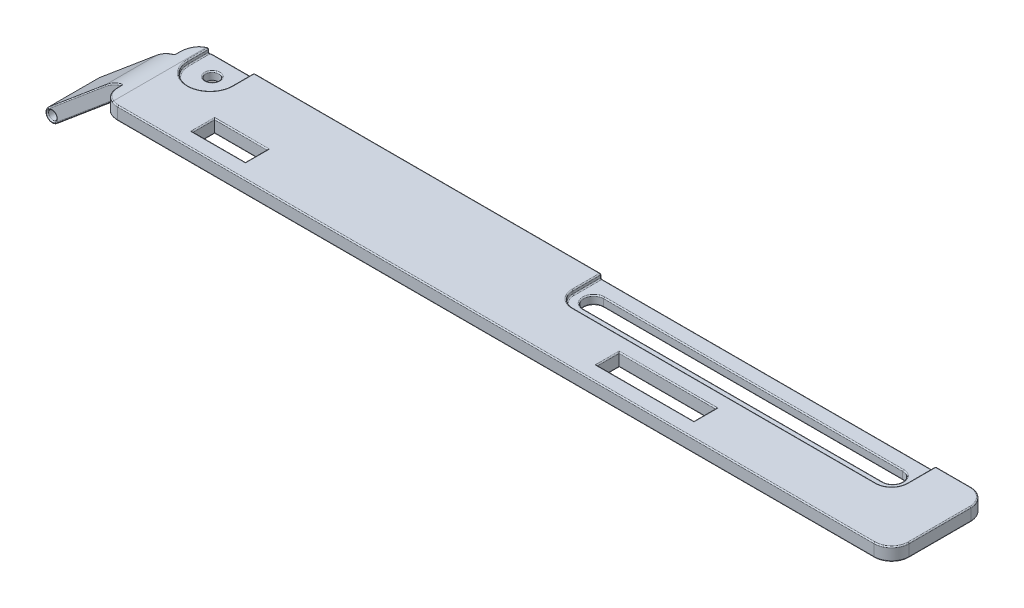
from build123d import *

# Parameters (mm, degrees)
BOSS_EXTRUDE1_DEPTH      = 11
BOSS_EXTRUDE1_DEPTH_BACK = 11
SKETCH1_R                = 1
SKETCH2_W                = 30.149933191
SKETCH2_H                = 27.250901153
CUT_EXTRUDE1_DEPTH       = 5
SKETCH3_W                = 71.820543682
SKETCH3_H                = 83.600632857
CUT_EXTRUDE2_DEPTH       = 5
CUT_EXTRUDE3_REACH       = 200.411
SKETCH4_W                = 12
SKETCH4_H                = 5
SKETCH4_W_2              = 22
CUT_EXTRUDE4_DEPTH       = 1
CUT_EXTRUDE5_REACH       = 200.411
SKETCH6_R                = 1.5
FILLET1_R                = 4
FILLET2_R                = 0.25


with BuildPart() as part:
    # Sketch1 → Boss-Extrude1 (new, two sides: drawn at the far end of the back side and taken through both)
    with BuildSketch(Plane.XY.offset(-BOSS_EXTRUDE1_DEPTH_BACK)):
        with BuildLine():
            Line((-182.788173754, -2.339555569), (-195, -12.586494468))
            ThreePointArc((-195, -12.586494468), (-197.113248079, -12.401609218), (-196.928362829, -10.288361138))
            Line((-196.928362829, -10.288361138), (-183.880084457, 0.660444431))
            ThreePointArc((-183.880084457, 0.660444431), (-180.872409793, 2.396926208), (-177.45220836, 3))
            Line((-177.45220836, 3), (0, 3))
            Line((0, 3), (0, 0))
            Line((0, 0), (-176.360297657, 0))
            ThreePointArc((-176.360297657, 0), (-179.780499091, -0.603073792), (-182.788173754, -2.339555569))
        make_face()
        with Locations((-195.964181415, -11.437427803)):
            Circle(SKETCH1_R, mode=Mode.SUBTRACT)
    extrude(amount=BOSS_EXTRUDE1_DEPTH + BOSS_EXTRUDE1_DEPTH_BACK)

    # Sketch2 → Cut-Extrude1 (cut)
    with BuildSketch(Plane.XY.offset(11)):
        with Locations((-195.074966596, -3.959703737)):
            Rectangle(SKETCH2_W, SKETCH2_H)
    extrude(amount=-CUT_EXTRUDE1_DEPTH, mode=Mode.SUBTRACT)

    # Sketch3 → Cut-Extrude2 (cut)
    with BuildSketch(Plane(origin=(0, 0, -11), x_dir=(-1, 0, 0), z_dir=(0, 0, -1))):
        with Locations((215.910271841, -13.071084551)):
            Rectangle(SKETCH3_W, SKETCH3_H)
    extrude(amount=-CUT_EXTRUDE2_DEPTH, mode=Mode.SUBTRACT)

    # Sketch4 → Cut-Extrude3 (cut, up to next)
    with BuildSketch(Plane(origin=(0, 3, 0), x_dir=(1, 0, 0), z_dir=(0, 1, 0)), mode=Mode.PRIVATE) as cut_extrude3_sk1:
        with Locations((-156.45220836, -5)):
            Rectangle(SKETCH4_W, SKETCH4_H)
    cut_extrude3_tool1 = extrude(cut_extrude3_sk1.sketch, amount=-CUT_EXTRUDE3_REACH, mode=Mode.PRIVATE) & part.part
    # Sketch4 → Cut-Extrude3 (cut, up to next)
    with BuildSketch(Plane(origin=(0, 3, 0), x_dir=(1, 0, 0), z_dir=(0, 1, 0)), mode=Mode.PRIVATE) as cut_extrude3_sk2:
        with Locations((-59.45220836, -5)):
            Rectangle(SKETCH4_W_2, SKETCH4_H)
    cut_extrude3_tool2 = extrude(cut_extrude3_sk2.sketch, amount=-CUT_EXTRUDE3_REACH, mode=Mode.PRIVATE) & part.part
    add(cut_extrude3_tool1.solids().sort_by_distance((-156.452208, 3, 5))[0], mode=Mode.SUBTRACT)
    add(cut_extrude3_tool2.solids().sort_by_distance((-59.452208, 3, 5))[0], mode=Mode.SUBTRACT)

    # Sketch5 → Cut-Extrude4 (cut)
    with BuildSketch(Plane(origin=(0, 3, 0), x_dir=(1, 0, 0), z_dir=(0, 1, 0))):
        with BuildLine():
            Line((-88, 11), (-12, 11))
            Line((-12, 11), (-12, 4.5))
            ThreePointArc((-12, 4.5), (-13.025126266, 2.025126266), (-15.5, 1))
            Line((-15.5, 1), (-84.5, 1))
            ThreePointArc((-84.5, 1), (-86.974873734, 2.025126266), (-88, 4.5))
            Line((-88, 4.5), (-88, 11))
        make_face()
        with BuildLine():
            Line((-177, 6), (-177, 11))
            Line((-177, 11), (-167, 11))
            Line((-167, 11), (-167, 6))
            ThreePointArc((-167, 6), (-172, 1), (-177, 6))
        make_face()
    extrude(amount=-CUT_EXTRUDE4_DEPTH, mode=Mode.SUBTRACT)

    # Sketch6 → Cut-Extrude5 (cut, up to next)
    with BuildSketch(Plane(origin=(0, 3, 0), x_dir=(1, 0, 0), z_dir=(0, 1, 0)), mode=Mode.PRIVATE) as cut_extrude5_sk1:
        with Locations(Location((-172, 6.5, 0), (0, 0, 180))):
            Circle(SKETCH6_R)
    cut_extrude5_tool1 = extrude(cut_extrude5_sk1.sketch, amount=-CUT_EXTRUDE5_REACH, mode=Mode.PRIVATE) & part.part
    # Sketch6 → Cut-Extrude5 (cut, up to next)
    with BuildSketch(Plane(origin=(0, 3, 0), x_dir=(1, 0, 0), z_dir=(0, 1, 0)), mode=Mode.PRIVATE) as cut_extrude5_sk2:
        with BuildLine():
            Line((-84, 7.5), (-16, 7.5))
            ThreePointArc((-16, 7.5), (-13.75, 5.25), (-16, 3))
            Line((-16, 3), (-84, 3))
            ThreePointArc((-84, 3), (-86.25, 5.25), (-84, 7.5))
        make_face()
    cut_extrude5_tool2 = extrude(cut_extrude5_sk2.sketch, amount=-CUT_EXTRUDE5_REACH, mode=Mode.PRIVATE) & part.part
    add(cut_extrude5_tool1.solids().sort_by_distance((-172, 3, -6.5))[0], mode=Mode.SUBTRACT)
    add(cut_extrude5_tool2.solids().sort_by_distance((-50, 3, -5.25))[0], mode=Mode.SUBTRACT)

    # Fillet1
    fillet1_edges = [part.edges().sort_by_distance(p)[0] for p in [
        (-180, 0.992049223, 11),
        (-180, 0.992049223, -11),
        (0, 1.5, 11),
        (0, 1.5, -11),
    ]]
    fillet(fillet1_edges, radius=FILLET1_R)

    # Fillet2
    fillet2_edges = [part.edges().sort_by_distance(p)[0] for p in [
        (-162.45220836, 0, 5),
        (-156.45220836, 0, 2.5),
        (-150.45220836, 0, 5),
        (-156.45220836, 0, 7.5),
        (-162.45220836, 3, 5),
        (-156.45220836, 3, 7.5),
        (-150.45220836, 3, 5),
        (-156.45220836, 3, 2.5),
        (-70.45220836, 0, 5),
        (-59.45220836, 0, 2.5),
        (-48.45220836, 0, 5),
        (-59.45220836, 0, 7.5),
        (-70.45220836, 3, 5),
        (-59.45220836, 3, 7.5),
        (-48.45220836, 3, 5),
        (-59.45220836, 3, 2.5),
        (-127.5, 3, -11),
        (-88, 2, -7.75),
        (-50, 2, -11),
        (-88, 2.5, -11),
        (-12, 2, -7.75),
        (-12, 2.5, -11),
        (-13.025126266, 2, -2.025126266),
        (-50, 2, -1),
        (-86.974873734, 2, -2.025126266),
        (-88, 3, -7.75),
        (-86.974873734, 3, -2.025126266),
        (-50, 3, -1),
        (-13.025126266, 3, -2.025126266),
        (-12, 3, -7.75),
        (-172, 2, -1),
        (-171.5, 2, -11),
        (-167, 2, -8.5),
        (-167, 2.5, -11),
        (-172, 3, -1),
        (-167, 3, -8.5),
        (-50, 2, -7.5),
        (-86.25, 2, -5.25),
        (-50, 2, -3),
        (-13.75, 2, -5.25),
        (-86.25, 0, -5.25),
        (-50, 0, -7.5),
        (-13.75, 0, -5.25),
        (-50, 0, -3),
        (-170.5, 0, -6.5),
        (-170.5, 2, -6.5),
        (-180, 2.669992645, 6.5),
        (-179.394637624, 2.809534579, -9.115758844),
        (-179.39451804, 2.809558256, 9.115950694),
        (-177, 3, -8.436491673),
        (-90, 3, 11),
        (0, 3, 0),
        (-8, 3, -11),
        (-1.171572875, 3, -9.828427125),
        (-1.171572875, 3, 9.828427125),
        (-177.228272667, 3, -10.806750091),
        (-176.738816109, 3, 10.931176765),
        (-90, 0, 11),
        (0, 0, 0),
        (-90, 0, -11),
        (-1.171572875, 0, -9.828427125),
        (-1.171572875, 0, 9.828427125),
        (-176.180332183, 0, -10.99593297),
        (-176.180332183, 0, 10.99593297),
        (-180, -0.6858942, -6.5),
        (-179.130203098, -0.391273546, -9.490347117),
        (-179.130203144, -0.391273559, 9.490347059),
        (-177, 2, -8.436491673),
        (-176.50401717, 2, -10.968118785),
        (-177, 2.5, -10.872983346),
        (-181.461540926, -1.39899325, 6),
        (-188.894086877, -7.463025018, 6),
        (-197.113248079, -12.401609218, 6),
        (-190.404223643, -4.813958354, 6),
        (-182.051145611, 1.879739645, 6),
        (-180, -0.6858942, 6.5),
        (-180, 0.992049223, 6),
        (-196.964181415, -11.437427803, 6),
        (-182.051145611, 1.879739645, -6),
        (-188.894086877, -7.463025018, -6),
        (-181.461540926, -1.39899325, -6),
        (-190.404223643, -4.813958354, -6),
        (-197.113248079, -12.401609218, -6),
        (-180, 2.669992645, -6.5),
        (-180, 0.992049223, -6),
        (-196.964181415, -11.437427803, -6),
    ]]
    fillet(fillet2_edges, radius=FILLET2_R - 0.0001)  # a hair under: the kernel refuses the full size


solid = part.part
